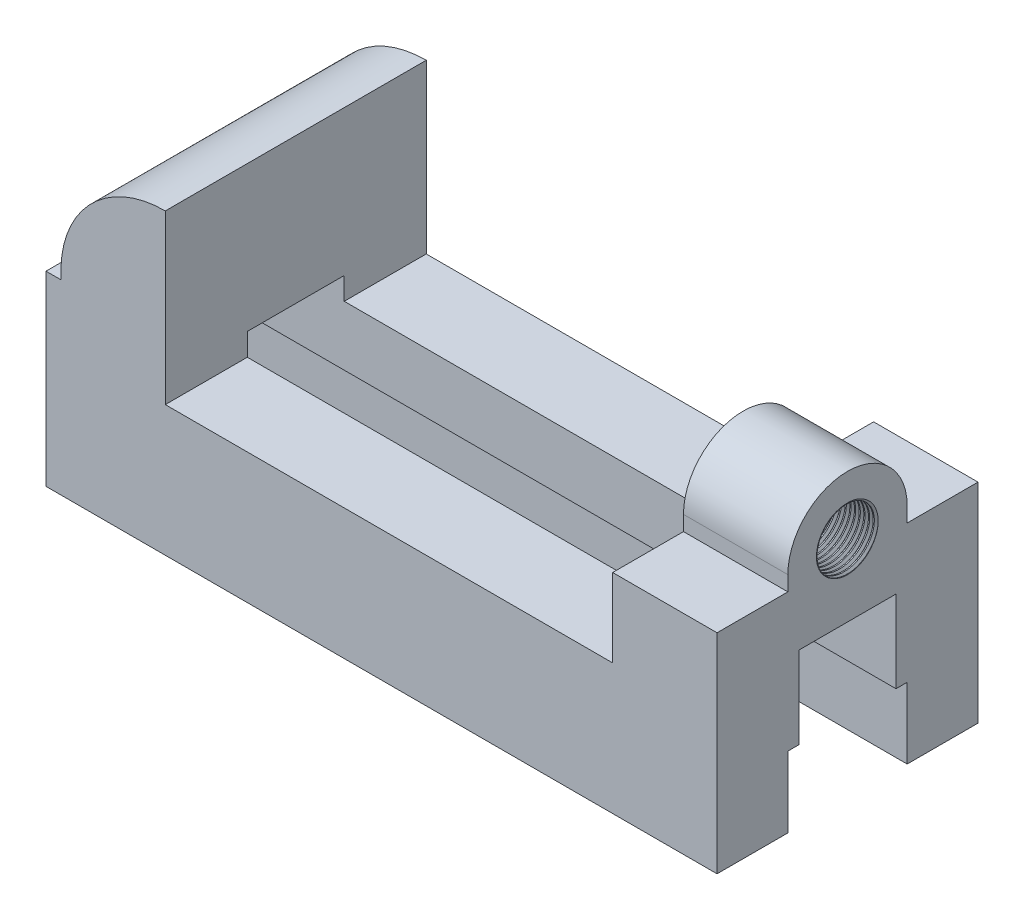
from build123d import *
from build123d.topology import SkipClean

# Parameters (mm, degrees)
SKETCH1_W           = 180
SKETCH1_H           = 80
BOSS_EXTRUDE1_DEPTH = 70
CUT_EXTRUDE1_REACH  = 211.045
BOSS_EXTRUDE2_DEPTH = 28
CUT_EXTRUDE2_DEPTH  = 28
SKETCH4_W           = 120
SKETCH4_H           = 26
BOSS_EXTRUDE3_DEPTH = 6
CUT_EXTRUDE3_DEPTH  = 210.045449604
THREAD1_PITCH       = 1.25


with BuildPart() as part:
    # Sketch1 → Boss-Extrude1 (new body)
    with BuildSketch(Plane.XY):
        with Locations((90, 40)):
            Rectangle(SKETCH1_W, SKETCH1_H)
    extrude(amount=-BOSS_EXTRUDE1_DEPTH)

    # Sketch2 → Cut-Extrude1 (cut, up to next)
    with BuildSketch(Plane.XY, mode=Mode.PRIVATE) as cut_extrude1_sk1:
        Polygon((180, 80), (32, 80), (32, 35), (152, 35), (152, 56), (180, 56), align=None)
    cut_extrude1_tool1 = extrude(cut_extrude1_sk1.sketch, amount=-CUT_EXTRUDE1_REACH, mode=Mode.PRIVATE) & part.part
    # Sketch2 → Cut-Extrude1 (cut, up to next)
    with BuildSketch(Plane.XY, mode=Mode.PRIVATE) as cut_extrude1_sk2:
        with BuildLine():
            Line((0, 80), (0, 50))
            Line((0, 50), (4.071519912, 50))
            ThreePointArc((4.071519912, 50), (11.506098468, 71.078784028), (32, 80))
            Line((32, 80), (0, 80))
        make_face()
    cut_extrude1_tool2 = extrude(cut_extrude1_sk2.sketch, amount=-CUT_EXTRUDE1_REACH, mode=Mode.PRIVATE) & part.part
    add(cut_extrude1_tool1.solids().sort_by_distance((100.189723, 58.662055, 0))[0], mode=Mode.SUBTRACT)
    add(cut_extrude1_tool2.solids().sort_by_distance((6.817505, 70.101549, 0))[0], mode=Mode.SUBTRACT)

    # Sketch3 → Boss-Extrude2 (add)
    with BuildSketch(Plane(origin=(180, 0, 0), x_dir=(0, 0, -1), z_dir=(1, 0, 0))):
        with BuildLine():
            ThreePointArc((51, 60), (35, 76), (19, 60))
            Line((19, 60), (19, 56))
            Line((19, 56), (28.07179677, 56))
            ThreePointArc((28.07179677, 56), (35, 68), (41.92820323, 56))
            Line((41.92820323, 56), (51, 56))
            Line((51, 56), (51, 60))
        make_face()
    extrude(amount=-BOSS_EXTRUDE2_DEPTH)

    # Sketch3<2> → Cut-Extrude2 (cut)
    with SkipClean():  # the faces are left unmerged after this step: merging them gives an invalid solid
        with BuildSketch(Plane(origin=(180, 0, 0), x_dir=(0, 0, -1), z_dir=(1, 0, 0))):
            with BuildLine():
                ThreePointArc((41.92820323, 56), (35, 68), (28.07179677, 56))
                Line((28.07179677, 56), (41.92820323, 56))
            make_face()
            with BuildLine():
                Line((41.92820323, 56), (28.07179677, 56))
                ThreePointArc((28.07179677, 56), (35, 52), (41.92820323, 56))
            make_face()
        extrude(amount=-CUT_EXTRUDE2_DEPTH, mode=Mode.SUBTRACT)

    # Sketch4 → Boss-Extrude3 (add)
    with SkipClean():  # the faces are left unmerged after this step: merging them gives an invalid solid
        with BuildSketch(Plane(origin=(0, 35, 0), x_dir=(1, 0, 0), z_dir=(0, 1, 0))):
            with Locations((92, 35)):
                Rectangle(SKETCH4_W, SKETCH4_H)
        extrude(amount=BOSS_EXTRUDE3_DEPTH)

    # Sketch5 → Cut-Extrude3 (cut, through all)
    with SkipClean():  # the faces are left unmerged after this step: merging them gives an invalid solid
        with BuildSketch(Plane.ZY):
            Polygon((-51, 0), (-51, 19), (-48, 19), (-48, 41), (-22, 41), (-22, 19), (-19, 19), (-19, 0), align=None)
        extrude(amount=-CUT_EXTRUDE3_DEPTH, mode=Mode.SUBTRACT)

    # Thread1: the profile of Thread Profile1 profile screwed along a right-hand helix of 32 turns, 8 arcs to a turn; built about Z, then put on its axis
    with SkipClean():  # the faces are left unmerged after this step: merging them gives an invalid solid
        thread1_z = Axis((0, 0, 0), (0, 0, 1))
        thread1_corners = [(7.9997, 0, -0.000173205), (8.676582344, 0, 0.390624998), (8.676582344, 0, 0.546874998), (7.9997, 0, 0.937673202)]
        with BuildLine(mode=Mode.PRIVATE) as thread1_profile:
            Line(thread1_corners[0], thread1_corners[1])
            Line(thread1_corners[1], thread1_corners[2])
            Line(thread1_corners[2], thread1_corners[3])
            Line(thread1_corners[3], thread1_corners[0])
        thread1_cap = Face(thread1_profile.wire())
        thread1_turn_angles = [0, 22.5, 45, 67.5, 90, 112.5, 135, 157.5, 180, 202.5, 225, 247.5, 270, 292.5, 315, 337.5, 360]
        thread1_turn_weights = [1, 0.9238795325112867, 1, 0.9238795325112867, 1, 0.9238795325112867, 1, 0.9238795325112867, 1, 0.9238795325112867, 1, 0.9238795325112867, 1, 0.9238795325112867, 1, 0.9238795325112867, 1]
        thread1_turn_rails = [Edge.make_bspline([Vector(p[0], p[1], 0).rotate(thread1_z, thread1_turn_angles[k]) / thread1_turn_weights[k] + Vector(0, 0, p[2] + THREAD1_PITCH * thread1_turn_angles[k] / 360) for k in range(17)], [0, 0, 0, 1, 1, 2, 2, 3, 3, 4, 4, 5, 5, 6, 6, 7, 7, 8, 8, 8], 2, thread1_turn_weights) for p in thread1_corners]
        thread1_turn_sides = [Face.make_surface_from_curves(thread1_turn_rails[p[0]], thread1_turn_rails[p[1]]) for p in [(0, 1), (1, 2), (2, 3), (3, 0)]]
        thread1 = Plane(origin=(182, 60, -35), x_dir=(0, 0, 1), z_dir=(-1, 0, 0)) * Solid(Shell([*[p.moved(Location((0, 0, THREAD1_PITCH * i))) for i in range(32) for p in thread1_turn_sides], thread1_cap, thread1_cap.rotate(thread1_z, 11520).moved(Location((0, 0, THREAD1_PITCH * 11520 / 360)))]))
        add(thread1, mode=Mode.SUBTRACT)


solid = part.part
